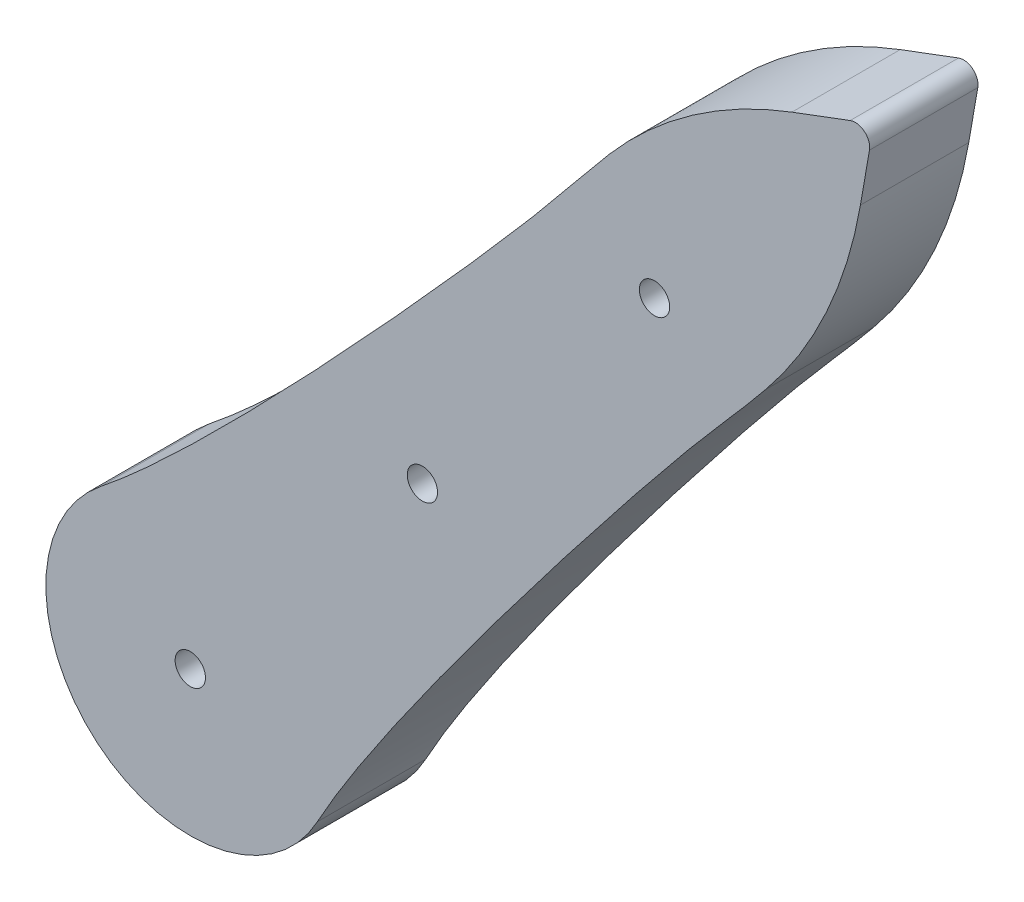
from build123d import *

# Parameters (mm, degrees)
SKETCH3_R           = 1.6
BOSS_EXTRUDE1_DEPTH = 15
CUT_EXTRUDE1_START  = -15
SKETCH4_R           = 1.6
CUT_EXTRUDE1_DEPTH  = 15
FILLET3_R           = 62
SKETCH5_R           = 2.1
CUT_EXTRUDE2_DEPTH  = 15
FILLET4_R           = 2


with BuildPart() as part:
    # Sketch3 → Boss-Extrude1 (new body)
    with BuildSketch(Plane.XY.offset(16)):
        with BuildLine():
            ThreePointArc((155.019115612, -142.985112199), (159.394881243, -97.849485606), (115.704809966, -109.996492831))
            add(Edge.make_bspline(
                [(115.704809966, -109.996492831), (101.94879758, -150.116707379), (78.178790791, -171.772825461), (58.717079478, -197.082387325), (16.356999542, -244.049515564), (0.72448619, -256.46124476)],
                knots=[0, 0, 0, 0, 0.619090324, 0.719090324, 1, 1, 1, 1], degree=3))
            ThreePointArc((0.72448619, -256.46124476), (0.304947846, -287.445485278), (30.74561606, -281.651963762))
            add(Edge.make_bspline(
                [(155.019115612, -142.985112199), (117.897123756, -163.498941991), (100.69762913, -190.668374405), (79.152067085, -214.229377889), (40.254225745, -264.101669257), (30.74561606, -281.651963762)],
                knots=[0, 0, 0, 0, 0.619090324, 0.719090324, 1, 1, 1, 1], degree=3))
        make_face()
        with Locations((135.218221977, -112.415707792)):
            Circle(SKETCH3_R, mode=Mode.SUBTRACT)
        with Locations((148.218221977, -112.415707792)):
            Circle(SKETCH3_R, mode=Mode.SUBTRACT)
        with Locations((148.218221977, -125.415707792)):
            Circle(SKETCH3_R, mode=Mode.SUBTRACT)
        with Locations((135.218221977, -125.415707792)):
            Circle(SKETCH3_R, mode=Mode.SUBTRACT)
        with Locations((77.439461008, -195.520152104)):
            Circle(SKETCH3_R, mode=Mode.SUBTRACT)
        with Locations((45.300080524, -233.82237426)):
            Circle(SKETCH3_R, mode=Mode.SUBTRACT)
        with Locations((13.16070004, -272.124596416)):
            Circle(SKETCH3_R, mode=Mode.SUBTRACT)
    extrude(amount=BOSS_EXTRUDE1_DEPTH)

    # Sketch4 → Cut-Extrude1 (cut)
    with BuildSketch(Plane.XY.offset(31).offset(CUT_EXTRUDE1_START)):
        with BuildLine():
            add(Edge.make_bspline(
                [(115.704809966, -109.996492831), (106.058622012, -138.130164086), (93.113701565, -155.703600822), (81.681620369, -169.238644056)],
                knots=[0, 0, 0, 0, 0.434127381, 0.434127381, 0.434127381, 0.434127381], degree=3))
            Line((81.681620369, -169.238644056), (107.801063948, -159.441089101))
            Line((107.801063948, -159.441089101), (103.173332299, -186.075062907))
            Line((103.173332299, -186.075062907), (159.144213742, -140.189748569))
            Line((159.144213742, -140.189748569), (159.161693107, -140.175418866))
            ThreePointArc((159.161693107, -140.175418866), (158.677203155, -97.267544882), (116.900921238, -107.068700404))
            ThreePointArc((116.900921238, -107.068700404), (116.260741116, -108.51538721), (115.704809966, -109.996492831))
        make_face()
        with Locations((135.218221977, -125.415707792)):
            Circle(SKETCH4_R, mode=Mode.SUBTRACT)
        with Locations((148.218221977, -125.415707792)):
            Circle(SKETCH4_R, mode=Mode.SUBTRACT)
        with Locations((135.218221977, -112.415707792)):
            Circle(SKETCH4_R, mode=Mode.SUBTRACT)
        with Locations((148.218221977, -112.415707792)):
            Circle(SKETCH4_R, mode=Mode.SUBTRACT)
    extrude(amount=CUT_EXTRUDE1_DEPTH, mode=Mode.SUBTRACT)


with BuildPart() as cut_extrude1_kept_piece:
    # of the separate pieces the step leaves, the one the design keeps (cut_extrude1_pieces_kept)
    add(part.part.solids().sort_by_distance((30.74561606, -281.651963762, 16))[0])

    # Fillet3
    fillet3_edges = [cut_extrude1_kept_piece.edges().sort_by_distance(p)[0] for p in [
        (81.681620369, -169.238644056, 23.5),
        (103.173332299, -186.075062907, 23.5),
    ]]
    fillet(fillet3_edges, radius=FILLET3_R)

    # Sketch5 → Cut-Extrude2 (cut)
    with BuildSketch(Plane.XY.offset(31)):
        with Locations((77.439461008, -195.520152104)):
            Circle(SKETCH5_R)
        with Locations((45.300080524, -233.82237426)):
            Circle(SKETCH5_R)
        with Locations((13.16070004, -272.124596416)):
            Circle(SKETCH5_R)
    extrude(amount=-CUT_EXTRUDE2_DEPTH, mode=Mode.SUBTRACT)

    # Fillet4
    fillet4_edges = [cut_extrude1_kept_piece.edges().sort_by_distance(p)[0] for p in [
        (107.801063948, -159.441089101, 23.5),
    ]]
    fillet(fillet4_edges, radius=FILLET4_R)


solid = cut_extrude1_kept_piece.part
